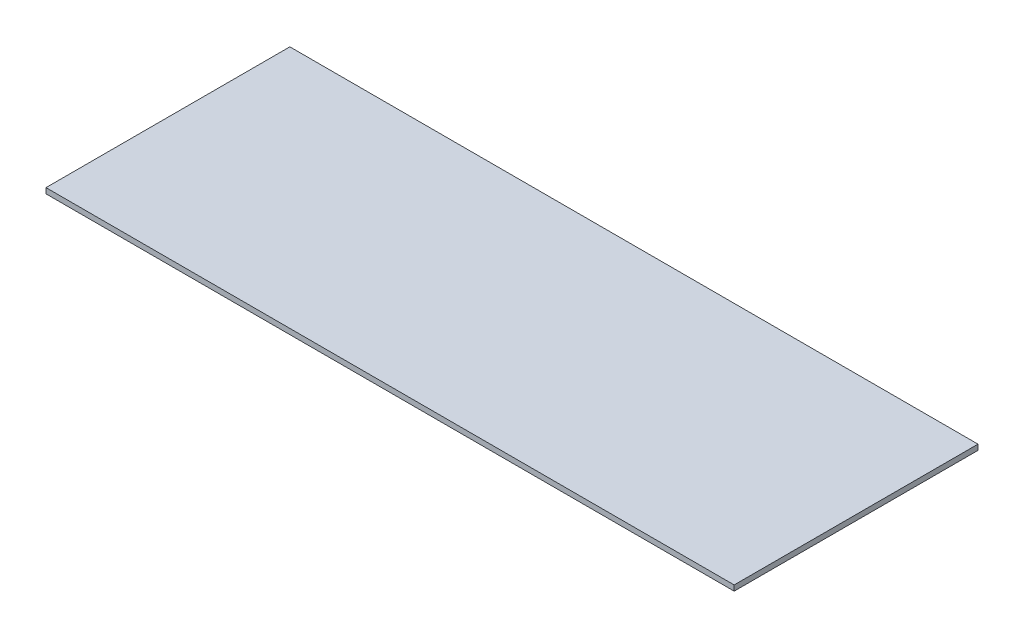
from build123d import *

# Parameters (mm, degrees)
SKETCH1_W           = 508
SKETCH1_H           = 180
BOSS_EXTRUDE1_DEPTH = 4


with BuildPart() as part:
    # Sketch1 → Boss-Extrude1 (new body)
    with BuildSketch(Plane(origin=(0, 0, 0), x_dir=(1, 0, 0), z_dir=(0, 1, 0))):
        with Locations((254, 90)):
            Rectangle(SKETCH1_W, SKETCH1_H)
    extrude(amount=BOSS_EXTRUDE1_DEPTH)


solid = part.part
